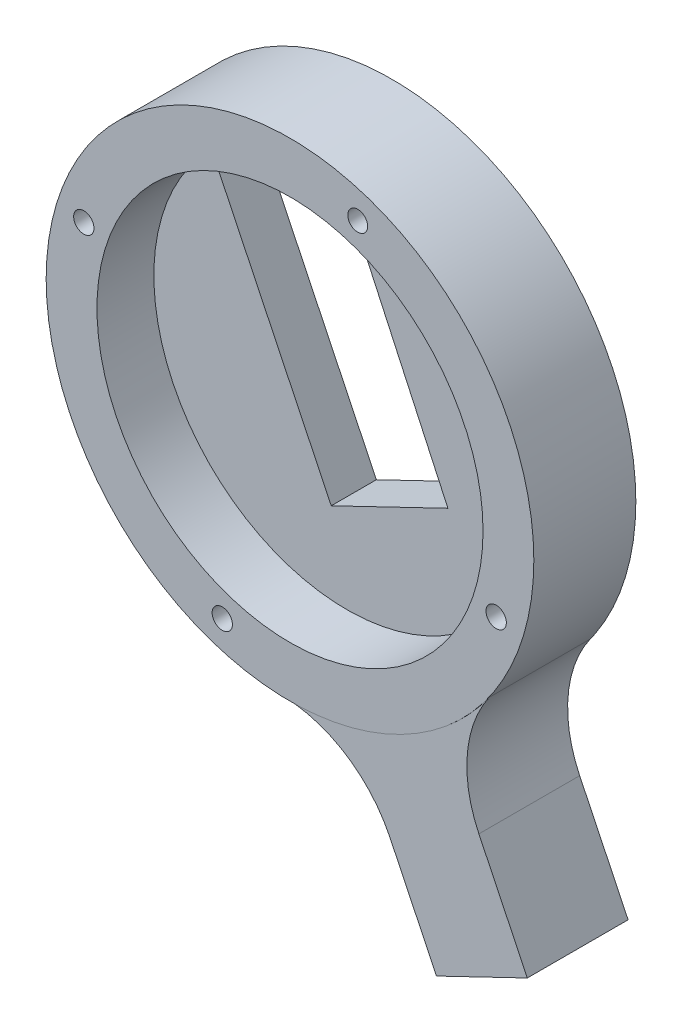
from build123d import *

# Parameters (mm, degrees)
SKETCH1_R                = 60
BOSS_EXTRUDE1_DEPTH      = 25.1
SKETCH3_R                = 47.5
CUT_EXTRUDE2_DEPTH       = 14
CUT_EXTRUDE5_DEPTH       = 89.487343728
CUT_EXTRUDE5_DEPTH_BACK  = 89.487343728
SKETCH2_R                = 2.494998654
SKETCH2_R_2              = 2.5
SKETCH2_R_3              = 2.444443829
SKETCH6_R                = 3
CUT_EXTRUDE6_DEPTH       = 6
CUT_EXTRUDE7_DEPTH       = 87
CUT_EXTRUDE7_DEPTH_BACK  = 87
BOSS_EXTRUDE2_DEPTH      = 30
BOSS_EXTRUDE2_DEPTH_BACK = 23
SKETCH8_W                = 24.8
SKETCH8_H                = 24.8
FILLET1_R                = 30


with BuildPart() as part:
    # Sketch1 → Boss-Extrude1 (new body)
    with BuildSketch(Plane.XY):
        Circle(SKETCH1_R)
    extrude(amount=BOSS_EXTRUDE1_DEPTH)

    # Sketch3 → Cut-Extrude2 (cut)
    with BuildSketch(Plane.XY.offset(25.1)):
        Circle(SKETCH3_R)
    extrude(amount=-CUT_EXTRUDE2_DEPTH, mode=Mode.SUBTRACT)

    # Sketch2 → Cut-Extrude5 (cut, two sides: drawn at the far end of the back side and taken through both)
    with BuildSketch(Plane.XY.offset(25.1).offset(-CUT_EXTRUDE5_DEPTH_BACK)):
        with Locations((-16.664697145, -50.733104448)):
            Circle(SKETCH2_R)
        with Locations((-50.733105114, 16.664696544)):
            Circle(SKETCH2_R_2)
        with Locations((16.664695878, 50.733104512)):
            Circle(SKETCH2_R_3)
        with Locations((50.733103846, -16.66469648)):
            Circle(SKETCH2_R_2)
    extrude(amount=CUT_EXTRUDE5_DEPTH + CUT_EXTRUDE5_DEPTH_BACK, mode=Mode.SUBTRACT)

    # Sketch6 → Cut-Extrude6 (cut)
    with BuildSketch(Plane(origin=(0, 0, 0), x_dir=(-1, 0, 0), z_dir=(0, 0, -1))):
        with Locations((11.973502988, 47.212610548)):
            Circle(SKETCH6_R)
        with Locations((27.381285989, 40.029281029)):
            Circle(SKETCH6_R)
        with Locations((-19.717656658, -20.762902692)):
            Circle(SKETCH6_R)
        with Locations((-4.309873657, -27.946232212)):
            Circle(SKETCH6_R)
    extrude(amount=-CUT_EXTRUDE6_DEPTH, mode=Mode.SUBTRACT)

    # Sketch7 → Cut-Extrude7 (cut, two sides: drawn at the far end of the back side and taken through both)
    with BuildSketch(Plane.XY.offset(11.1).offset(-CUT_EXTRUDE7_DEPTH_BACK)):
        Polygon((-32.722381774, 32.714358343), (-3.845549598, -27.273283804), (24.859322702, -13.455341469), (-3.0425496, 47.001626555), align=None)
    extrude(amount=CUT_EXTRUDE7_DEPTH + CUT_EXTRUDE7_DEPTH_BACK, mode=Mode.SUBTRACT)

    # Sketch8 → Boss-Extrude2 (add, two sides: drawn at the far end of the back side and taken through both)
    with BuildSketch(Plane(origin=(33.107502317, -68.776276749, 0), x_dir=(-0.9010375187182339, -0.43374115537044483, 0), z_dir=(0.43374115537044483, -0.9010375187182339, 0)).offset(-BOSS_EXTRUDE2_DEPTH_BACK)):
        with Locations((-0.981202476, -12.478185074)):
            Rectangle(SKETCH8_W, SKETCH8_H)
    extrude(amount=BOSS_EXTRUDE2_DEPTH + BOSS_EXTRUDE2_DEPTH_BACK)

    # Fillet1
    fillet1_edges = [part.edges().sort_by_distance(p)[0] for p in [
        (15.260065741, -58.026979876, 12.478185074),
        (37.425978865, -46.896653463, 12.478185074),
    ]]
    fillet(fillet1_edges, radius=FILLET1_R)


solid = part.part
